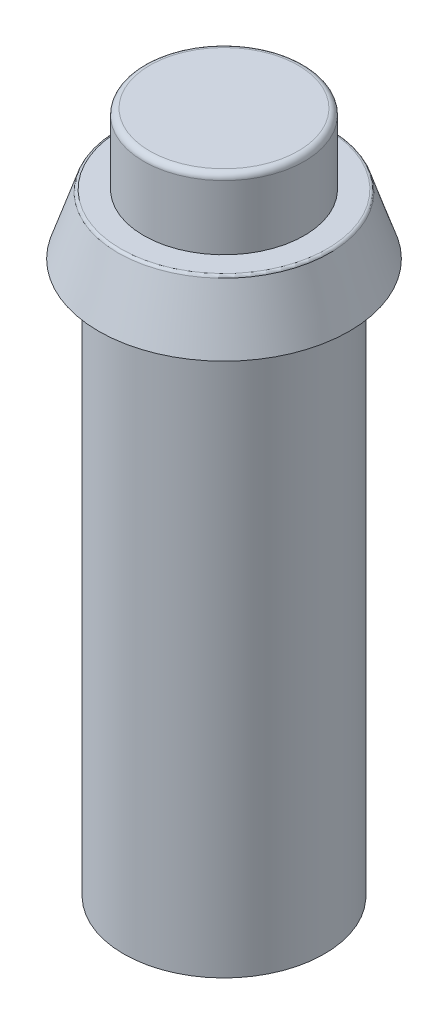
from build123d import *

# Parameters (mm, degrees)
SKETCH1_R           = 5
BOSS_EXTRUDE1_DEPTH = 27.5
SKETCH2_R           = 6.25
BOSS_EXTRUDE2_DEPTH = 3
SKETCH3_R           = 4
BOSS_EXTRUDE3_DEPTH = 3.5
CHAMFER1_SIZE       = 3
CHAMFER1_SIZE_2     = 1
FILLET1_R           = 0.3
FILLET2_R           = 0.15


with BuildPart() as part:
    # Sketch1 → Boss-Extrude1 (new body)
    with BuildSketch(Plane(origin=(0, 0, 0), x_dir=(1, 0, 0), z_dir=(0, 1, 0))):
        with Locations(Location((0, 0, 0), (0, 0, 270))):
            Circle(SKETCH1_R)
    extrude(amount=BOSS_EXTRUDE1_DEPTH)

    # Sketch2 → Boss-Extrude2 (add)
    with BuildSketch(Plane(origin=(0, 27.5, 0), x_dir=(1, 0, 0), z_dir=(0, 1, 0))):
        with Locations(Location((0, 0, 0), (0, 0, 270))):
            Circle(SKETCH2_R)
    extrude(amount=BOSS_EXTRUDE2_DEPTH)

    # Sketch3 → Boss-Extrude3 (add)
    with BuildSketch(Plane(origin=(0, 30.5, 0), x_dir=(1, 0, 0), z_dir=(0, 1, 0))):
        with Locations(Location((0, 0, 0), (0, 0, 270))):
            Circle(SKETCH3_R)
    extrude(amount=BOSS_EXTRUDE3_DEPTH)

    # Chamfer1
    # the kernel refuses this chamfer: 3, 1 mm, written as the material it takes off along each edge
    with BuildSketch(Plane(origin=(0, 30.5, 0), x_dir=(0, 0, 1), z_dir=(-1, 0, 0))) as chamfer1_piece_1:
        Polygon((6.25, -CHAMFER1_SIZE), (6.25 - CHAMFER1_SIZE_2, 0), (6.25, 0), align=None)
    revolve(axis=Axis((0, 30.5, 0), (0, 1, 0)), mode=Mode.SUBTRACT)

    # Fillet1
    fillet1_edges = [part.edges().sort_by_distance(p)[0] for p in [
        (0, 34, -4),
    ]]
    fillet(fillet1_edges, radius=FILLET1_R)

    # Fillet2
    fillet2_edges = [part.edges().sort_by_distance(p)[0] for p in [
        (0, 30.5, -5.25),
    ]]
    fillet(fillet2_edges, radius=FILLET2_R)


solid = part.part
